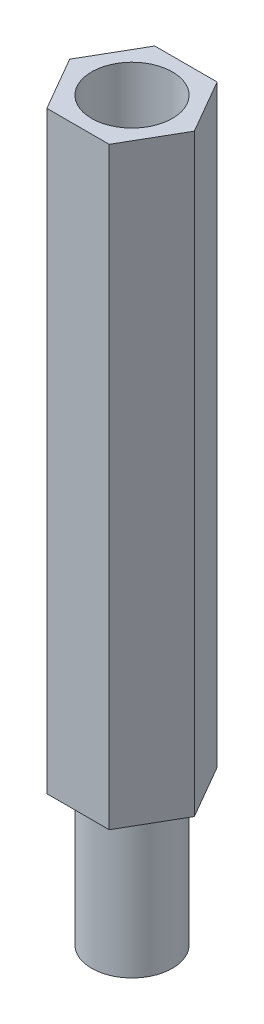
from build123d import *

# Parameters (mm, degrees)
EXTRUDE_1_DEPTH     = 25
SKETCH_2_R          = 1.7
EXTRUDE_2_DEPTH     = 6
SKETCH_3_R          = 1.7
CUT_EXTRUDE_1_DEPTH = 4


with BuildPart() as part:
    # 草图1 → 凸台-拉伸1 (new body)
    with BuildSketch(Plane(origin=(0, 0, 0), x_dir=(1, 0, 0), z_dir=(0, 1, 0))):
        Polygon((1.3125, -2.273316685), (2.625, 0), (1.3125, 2.273316685), (-1.3125, 2.273316685), (-2.625, 0), (-1.3125, -2.273316685), align=None)
    extrude(amount=EXTRUDE_1_DEPTH)

    # 草图2 → 凸台-拉伸2 (add)
    with BuildSketch(Plane(origin=(0, 0, 0), x_dir=(1, 0, 0), z_dir=(0, 1, 0))):
        Circle(SKETCH_2_R)
    extrude(amount=-EXTRUDE_2_DEPTH)

    # 草图3 → 切除-拉伸1 (cut)
    with BuildSketch(Plane(origin=(0, 25, 0), x_dir=(1, 0, 0), z_dir=(0, 1, 0))):
        Circle(SKETCH_3_R)
    extrude(amount=-CUT_EXTRUDE_1_DEPTH, mode=Mode.SUBTRACT)


solid = part.part
